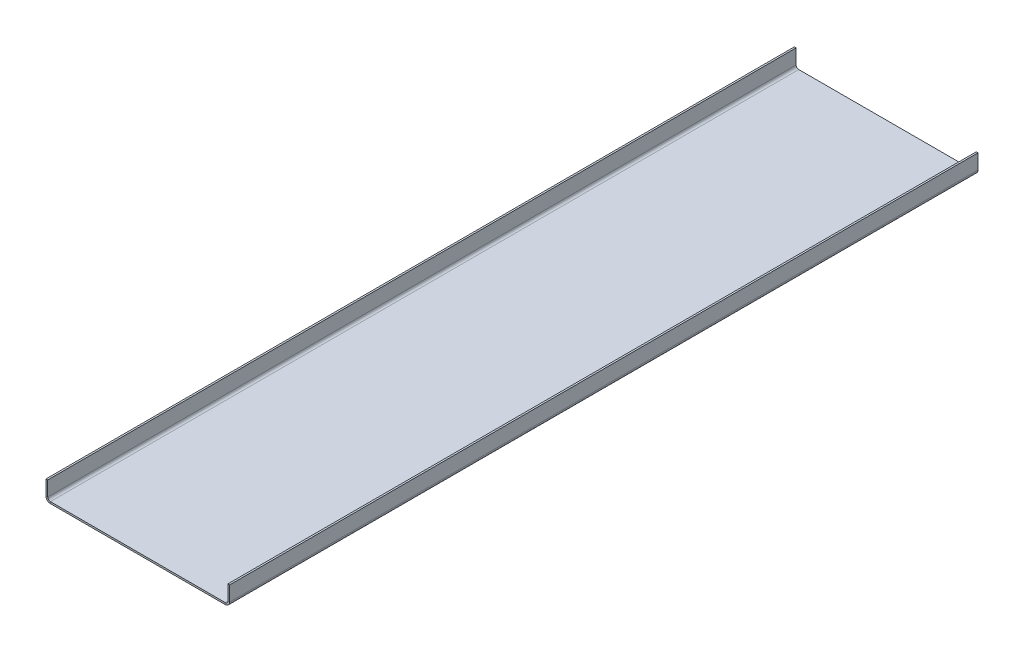
from build123d import *

# Parameters (mm, degrees)
SKETCH1_W               = 200
SKETCH1_H               = 856
BASE_FLANGE1_DEPTH      = 2
EDGE_FLANGE1_DEPTH      = 856
EDGE_FLANGE1_BEND_DEPTH = 856


# Sheet-metal steps are written as plain solids
with BuildPart() as part:
    # Sketch1 → Base-Flange1 (new body)
    with BuildSketch(Plane(origin=(0, 0, 0), x_dir=(1, 0, 0), z_dir=(0, 1, 0))):
        Rectangle(SKETCH1_W, SKETCH1_H)
    extrude(amount=-BASE_FLANGE1_DEPTH)

    # Edge-Flange1 section (across the edge) → Edge-Flange1 (add)
    with BuildSketch(Plane(origin=(103, 0, 428), x_dir=(-1, 0, 0), z_dir=(0, 0, -1))):
        with BuildLine():
            Line((-2, 3), (-2, 20))
            Line((-2, 20), (0, 20))
            Line((0, 20), (0, 3))
            ThreePointArc((0, 3), (0.878679656, 0.878679656), (3, 0))
            Line((3, 0), (3, -2))
            ThreePointArc((3, -2), (-0.535533906, -0.535533906), (-2, 3))
        make_face()
    extrude(amount=EDGE_FLANGE1_DEPTH)

    # Edge-Flange1 section 2 (across the edge) → Edge-Flange1 bend (add)
    with BuildSketch(Plane(origin=(-103, 0, -428), x_dir=(1, 0, 0), z_dir=(0, 0, 1))):
        with BuildLine():
            Line((-2, 3), (-2, 20))
            Line((-2, 20), (0, 20))
            Line((0, 20), (0, 3))
            ThreePointArc((0, 3), (0.878679656, 0.878679656), (3, 0))
            Line((3, 0), (3, -2))
            ThreePointArc((3, -2), (-0.535533906, -0.535533906), (-2, 3))
        make_face()
    extrude(amount=EDGE_FLANGE1_BEND_DEPTH)


solid = part.part
